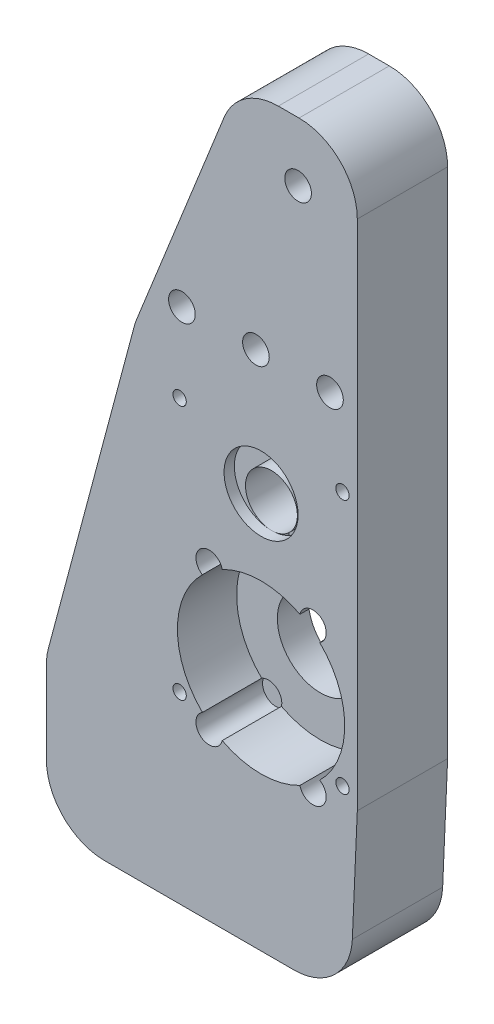
from build123d import *

# Parameters (mm, degrees)
SKETCH1_R             = 2.286
SKETCH1_R_2           = 7.366
BOSS_EXTRUDE1_DEPTH   = 15.494
CAVITY1_START         = 5.334
CAVITY1_OUTLINE_R     = 1.143
CAVITY1_OUTLINE_R_2   = 7.366
CAVITY1_OUTLINE_R_3   = 4.445
CAVITY1_DEPTH         = 10.16
CAVITY1_START_2       = 2.286
CAVITY1_2_OUTLINE_R   = 1.143
CAVITY1_2_OUTLINE_R_2 = 4.445
CAVITY1_2_DEPTH       = 3.048
CAVITY1_3_OUTLINE_R   = 1.905
CAVITY1_3_DEPTH       = 3.302
CAVITY1_START_3       = 13.716
CAVITY1_4_DEPTH       = 1.778
CAVITY1_START_4       = 4.064
CAVITY1_5_OUTLINE_R   = 2.286
CAVITY1_5_DEPTH       = 1.27
CAVITY1_START_5       = 2.032
CAVITY1_6_DEPTH       = 0.254
CHAMFER1_SIZE         = 1.27
CHAMFER1_SIZE2        = 29.087782247
FILLET1_R             = 10


# Read off the part's stored shape, not the designer's step: Cavity1
with BuildPart() as part:
    # Sketch1 → Boss-Extrude1 (new body)
    with BuildSketch(Plane.XY):
        Polygon((-10.16, 10.16), (-27.94, -34.29), (-43.18, -91.44), (-43.18, -116.84), (10.16, -116.84), (10.16, 10.16), align=None)
        Circle(SKETCH1_R, mode=Mode.SUBTRACT)
        with Locations((-6.35, -76.2)):
            Circle(SKETCH1_R_2, mode=Mode.SUBTRACT)
        with Locations((-7.228672556, -27.94)):
            Circle(SKETCH1_R, mode=Mode.SUBTRACT)
        with Locations((-19.928672556, -27.94)):
            Circle(SKETCH1_R, mode=Mode.SUBTRACT)
        with Locations((5.471327444, -27.94)):
            Circle(SKETCH1_R, mode=Mode.SUBTRACT)
    extrude(amount=BOSS_EXTRUDE1_DEPTH)

    # Cavity1 outline → Cavity1 (cut)
    # profile 1 of 6: a face of its own
    with BuildSketch(Plane.XY.offset(CAVITY1_START)):
        with Locations((7.62, -85.344)):
            Circle(CAVITY1_OUTLINE_R)
    # profile 2 of 6: a face of its own
    with BuildSketch(Plane.XY.offset(CAVITY1_START)):
        with BuildLine():
            ThreePointArc((3.714128852, -86.430567503), (8.001, -76.2), (3.714128852, -65.969432496))
            ThreePointArc((3.714128852, -65.969432496), (3.886847552, -62.160894786), (0.313505747, -63.489811482))
            ThreePointArc((0.313505747, -63.489811482), (-6.35, -61.849), (-13.013505747, -63.489811482))
            ThreePointArc((-13.013505747, -63.489811482), (-16.586847552, -62.160894786), (-16.414128852, -65.969432496))
            ThreePointArc((-16.414128852, -65.969432496), (-20.701, -76.2), (-16.414128852, -86.430567503))
            ThreePointArc((-16.414128852, -86.430567503), (-16.586847552, -90.239105214), (-13.013505747, -88.910188518))
            ThreePointArc((-13.013505747, -88.910188518), (-6.35, -90.551), (0.313505747, -88.910188518))
            ThreePointArc((0.313505747, -88.910188518), (3.886847552, -90.239105214), (3.714128852, -86.430567503))
        make_face()
        with Locations((-6.35, -76.2)):
            Circle(CAVITY1_OUTLINE_R_2, mode=Mode.SUBTRACT)
    # profile 3 of 6: a face of its own
    with BuildSketch(Plane.XY.offset(CAVITY1_START)):
        with Locations((7.62, -41.656)):
            Circle(CAVITY1_OUTLINE_R)
    # profile 4 of 6: a face of its own
    with BuildSketch(Plane.XY.offset(CAVITY1_START)):
        with Locations((-6.35, -50.8)):
            Circle(CAVITY1_OUTLINE_R_3)
    # profile 5 of 6: a face of its own
    with BuildSketch(Plane.XY.offset(CAVITY1_START)):
        with Locations((-20.32, -85.344)):
            Circle(CAVITY1_OUTLINE_R)
    # profile 6 of 6: a face of its own
    with BuildSketch(Plane.XY.offset(CAVITY1_START)):
        with Locations((-20.32, -41.656)):
            Circle(CAVITY1_OUTLINE_R)
    extrude(amount=CAVITY1_DEPTH, mode=Mode.SUBTRACT)

    # Cavity1 2 outline → Cavity1 2 (cut)
    with BuildSketch(Plane.XY.offset(CAVITY1_START_2)):
        with Locations((7.62, -85.344)):
            Circle(CAVITY1_2_OUTLINE_R)
        with Locations((7.62, -41.656)):
            Circle(CAVITY1_2_OUTLINE_R)
        with BuildLine():
            ThreePointArc((-9.97043784, -62.313185), (-6.35, -67.31), (-2.72956216, -62.313185))
            ThreePointArc((-2.72956216, -62.313185), (-6.35, -61.849), (-9.97043784, -62.313185))
        make_face()
        with Locations((-6.35, -50.8)):
            Circle(CAVITY1_2_OUTLINE_R_2)
        with Locations((-20.32, -85.344)):
            Circle(CAVITY1_2_OUTLINE_R)
        with Locations((-20.32, -41.656)):
            Circle(CAVITY1_2_OUTLINE_R)
    extrude(amount=CAVITY1_2_DEPTH, mode=Mode.SUBTRACT)

    # Cavity1 3 outline → Cavity1 3 (cut)
    with BuildSketch(Plane.XY):
        with Locations((7.62, -85.344)):
            Circle(CAVITY1_3_OUTLINE_R)
        with Locations((7.62, -41.656)):
            Circle(CAVITY1_3_OUTLINE_R)
        with Locations((-20.32, -85.344)):
            Circle(CAVITY1_3_OUTLINE_R)
        with Locations((-20.32, -41.656)):
            Circle(CAVITY1_3_OUTLINE_R)
    extrude(amount=CAVITY1_3_DEPTH, mode=Mode.SUBTRACT)

    # Cavity1 4 outline → Cavity1 4 (cut)
    with BuildSketch(Plane.XY.offset(CAVITY1_START_3)):
        with BuildLine():
            Line((-2.021487251, -51.810941334), (-0.080238237, -49.901274035))
            ThreePointArc((-0.080238237, -49.901274035), (-0.020091344, -49.399733991), (0, -48.895))
            ThreePointArc((0, -48.895), (-0.99932539, -45.475529103), (-3.682765738, -43.132330359))
            Line((-3.682765738, -43.132330359), (-4.827346661, -46.623931058))
            ThreePointArc((-4.827346661, -46.623931058), (-2.708144766, -48.2514876), (-1.905, -50.8))
            ThreePointArc((-1.905, -50.8), (-1.93421784, -51.308815207), (-2.021487251, -51.810941334))
        make_face()
        with BuildLine():
            ThreePointArc((-5.088099029, -55.118351664), (-1.768956382, -53.292333211), (-0.080238237, -49.901274035))
            Line((-0.080238237, -49.901274035), (-2.021487251, -51.810941334))
            ThreePointArc((-2.021487251, -51.810941334), (-3.122489186, -53.856337505), (-5.104913564, -55.067058093))
            Line((-5.104913564, -55.067058093), (-5.088099029, -55.118351664))
        make_face()
        with BuildLine():
            Line((-4.827346661, -46.623931058), (-3.682765738, -43.132330359))
            ThreePointArc((-3.682765738, -43.132330359), (-6.35, -42.545), (-9.017234262, -43.132330359))
            Line((-9.017234262, -43.132330359), (-7.872653339, -46.623931058))
            ThreePointArc((-7.872653339, -46.623931058), (-6.35, -46.355), (-4.827346661, -46.623931058))
        make_face()
        with BuildLine():
            ThreePointArc((-5.446692173, -55.180422418), (-5.266950842, -55.15195649), (-5.088099029, -55.118351664))
            Line((-5.088099029, -55.118351664), (-5.104913564, -55.067058093))
            ThreePointArc((-5.104913564, -55.067058093), (-5.256864048, -55.108489154), (-5.410186924, -55.144511064))
            Line((-5.410186924, -55.144511064), (-5.446692173, -55.180422418))
        make_face()
        with BuildLine():
            Line((-7.872653339, -46.623931058), (-9.017234262, -43.132330359))
            ThreePointArc((-9.017234262, -43.132330359), (-11.955544051, -45.911650223), (-12.619761763, -49.901274035))
            Line((-12.619761763, -49.901274035), (-10.678512749, -51.810941334))
            ThreePointArc((-10.678512749, -51.810941334), (-10.259642573, -48.6851194), (-7.872653339, -46.623931058))
        make_face()
        with BuildLine():
            ThreePointArc((-6.35, -55.245), (-5.897193393, -55.228835029), (-5.446692173, -55.180422418))
            Line((-5.446692173, -55.180422418), (-5.410186924, -55.144511064))
            ThreePointArc((-5.410186924, -55.144511064), (-5.877414917, -55.219806369), (-6.35, -55.245))
        make_face()
        with BuildLine():
            Line((-7.289813076, -55.144511064), (-7.253307826, -55.180422418))
            ThreePointArc((-7.253307826, -55.180422418), (-6.802806607, -55.228835029), (-6.35, -55.245))
            ThreePointArc((-6.35, -55.245), (-6.822585083, -55.219806369), (-7.289813076, -55.144511064))
        make_face()
        with BuildLine():
            ThreePointArc((-7.611900971, -55.118351664), (-7.433049158, -55.15195649), (-7.253307826, -55.180422418))
            Line((-7.253307826, -55.180422418), (-7.289813076, -55.144511064))
            ThreePointArc((-7.289813076, -55.144511064), (-7.443135952, -55.108489154), (-7.595086436, -55.067058093))
            Line((-7.595086436, -55.067058093), (-7.611900971, -55.118351664))
        make_face()
        with BuildLine():
            Line((-10.678512749, -51.810941334), (-12.619761763, -49.901274035))
            ThreePointArc((-12.619761763, -49.901274035), (-10.931043618, -53.292333211), (-7.611900971, -55.118351664))
            Line((-7.611900971, -55.118351664), (-7.595086436, -55.067058093))
            ThreePointArc((-7.595086436, -55.067058093), (-9.577510814, -53.856337505), (-10.678512749, -51.810941334))
        make_face()
    extrude(amount=CAVITY1_4_DEPTH, mode=Mode.SUBTRACT)

    # Cavity1 5 outline → Cavity1 5 (cut)
    with BuildSketch(Plane.XY.offset(CAVITY1_START_4)):
        with Locations((2.54, -88.392)):
            Circle(CAVITY1_5_OUTLINE_R)
        with Locations((2.54, -64.008)):
            Circle(CAVITY1_5_OUTLINE_R)
        with Locations((-15.24, -88.392)):
            Circle(CAVITY1_5_OUTLINE_R)
        with Locations((-15.24, -64.008)):
            Circle(CAVITY1_5_OUTLINE_R)
    extrude(amount=CAVITY1_5_DEPTH, mode=Mode.SUBTRACT)

    # Cavity1 6 outline → Cavity1 6 (cut)
    with BuildSketch(Plane.XY.offset(CAVITY1_START_5)):
        with BuildLine():
            ThreePointArc((-9.97043784, -62.313185), (-6.35, -67.31), (-2.72956216, -62.313185))
            ThreePointArc((-2.72956216, -62.313185), (-6.35, -61.849), (-9.97043784, -62.313185))
        make_face()
    extrude(amount=CAVITY1_6_DEPTH, mode=Mode.SUBTRACT)

    # Chamfer1
    chamfer1_edges = [part.edges().sort_by_distance(p)[0] for p in [
        (10.16, -116.84, 7.747),
    ]]
    chamfer1_side = [part.faces().sort_by_distance(p)[0] for p in [
        (-16.51, -116.84, 7.747),
    ]]
    chamfer(chamfer1_edges, length=CHAMFER1_SIZE, length2=CHAMFER1_SIZE2, reference=chamfer1_side[0])

    # Fillet1
    fillet1_edges = [part.edges().sort_by_distance(p)[0] for p in [
        (-10.16, 10.16, 7.747),
        (10.16, 10.16, 7.747),
        (8.89, -116.84, 7.747),
        (-43.18, -116.84, 7.747),
        (-43.18, -91.44, 7.747),
        (-27.94, -34.29, 7.747),
    ]]
    fillet(fillet1_edges, radius=FILLET1_R)


solid = part.part
